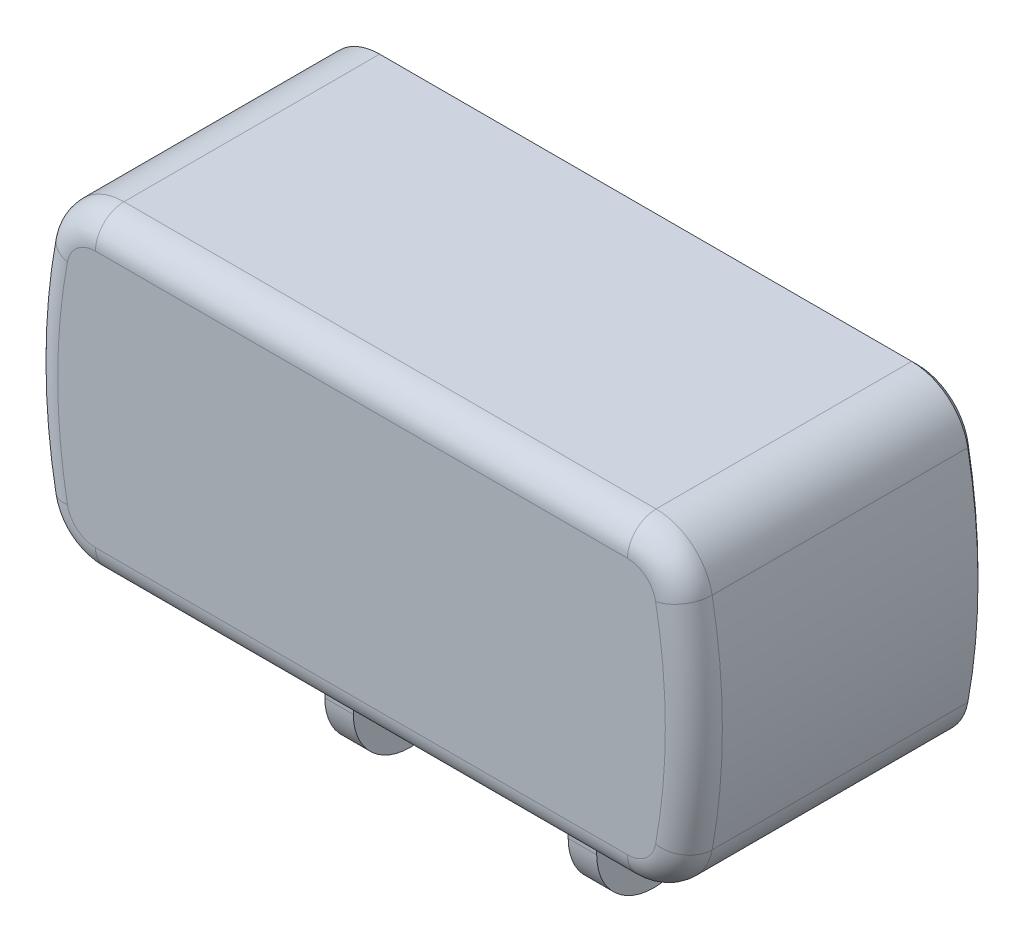
from build123d import *
from OCP.BRepFilletAPI import BRepFilletAPI_MakeChamfer

# Parameters (mm, degrees)
BOSS_EXTRUDE5_DEPTH = 50.8
FILLET9_R           = 5
CHAMFER1_SIZE       = 1
SKETCH8_R           = 1.35
BOSS_EXTRUDE6_DEPTH = 5
CUT_EXTRUDE3_DEPTH  = 20
CHAMFER2_SIZE       = 20
CHAMFER2_SIZE_2     = 0.69841539
SKETCH15_R          = 1.35
CUT_EXTRUDE4_DEPTH  = 5


with BuildPart() as part:
    # Sketch2 → Boss-Extrude5 (new body)
    with BuildSketch(Plane.XY):
        with BuildLine():
            Line((46.625, 27.5), (-46.625, 27.5))
            ThreePointArc((-46.625, 27.5), (-53.017219792, 25.190222762), (-56.456518829, 19.327905227))
            ThreePointArc((-56.456518829, 19.327905227), (-58.238005123, 0), (-56.456518829, -19.327905227))
            ThreePointArc((-56.456518829, -19.327905227), (-53.017219792, -25.190222762), (-46.625, -27.5))
            Line((-46.625, -27.5), (46.625, -27.5))
            ThreePointArc((46.625, -27.5), (53.017219792, -25.190222762), (56.456518829, -19.327905227))
            ThreePointArc((56.456518829, -19.327905227), (58.238005123, 0), (56.456518829, 19.327905227))
            ThreePointArc((56.456518829, 19.327905227), (53.017219792, 25.190222762), (46.625, 27.5))
        make_face()
    extrude(amount=BOSS_EXTRUDE5_DEPTH)

    # Fillet9
    fillet9_edges = [part.edges().sort_by_distance(p)[0] for p in [
        (53.017219792, -25.190222762, 50.8),
        (58.238005123, 0, 50.8),
        (53.017219792, 25.190222762, 50.8),
        (0, 27.5, 50.8),
        (-53.017219792, 25.190222762, 50.8),
        (-58.238005123, 0, 50.8),
        (-53.017219792, -25.190222762, 50.8),
        (0, -27.5, 50.8),
    ]]
    fillet(fillet9_edges, radius=FILLET9_R)

    # Chamfer1
    chamfer1_edges = [part.edges().sort_by_distance(p)[0] for p in [
        (58.238005123, 0, 0),
        (53.017219792, -25.190222762, 0),
        (0, -27.5, 0),
        (-53.017219792, -25.190222762, 0),
        (-58.238005123, 0, 0),
        (-53.017219792, 25.190222762, 0),
        (0, 27.5, 0),
        (53.017219792, 25.190222762, 0),
    ]]
    chamfer(chamfer1_edges, length=CHAMFER1_SIZE)

    # Sketch8 → Boss-Extrude6 (add)
    # profile 1 of 2: a face of its own
    with BuildSketch(Plane(origin=(18.825019181, 0, 0), x_dir=(0, 0, -1), z_dir=(1, 0, 0))):
        with BuildLine():
            Line((-13.405087735, -32.61), (-8.405087735, -27.5))
            Line((-8.405087735, -27.5), (-13.405087735, -27.5))
            Line((-13.405087735, -27.5), (-33.413673421, -27.5))
            Line((-33.413673421, -27.5), (-38.413673421, -27.5))
            Line((-38.413673421, -27.5), (-33.405087735, -32.61))
            Line((-33.405087735, -32.61), (-33.405087735, -42.61))
            ThreePointArc((-33.405087735, -42.61), (-23.405087735, -52.61), (-13.405087735, -42.61))
            Line((-13.405087735, -42.61), (-13.405087735, -32.61))
        make_face()
        with BuildLine():
            ThreePointArc((-33.105086536, -42.61), (-23.405087735, -32.910001198), (-13.705088933, -42.61))
            ThreePointArc((-13.705088933, -42.61), (-23.405087735, -52.309998802), (-33.105086536, -42.61))
        make_face(mode=Mode.SUBTRACT)
    # profile 2 of 2: a face of its own
    with BuildSketch(Plane(origin=(18.825019181, 0, 0), x_dir=(0, 0, -1), z_dir=(1, 0, 0))):
        with BuildLine():
            ThreePointArc((-33.105086536, -42.61), (-23.405087735, -52.309998802), (-13.705088933, -42.61))
            ThreePointArc((-13.705088933, -42.61), (-23.405087735, -32.910001198), (-33.105086536, -42.61))
        make_face()
        with Locations((-30.405089608, -42.61)):
            Circle(SKETCH8_R, mode=Mode.SUBTRACT)
        with Locations((-23.405087735, -49.610001873)):
            Circle(SKETCH8_R, mode=Mode.SUBTRACT)
        with Locations((-16.405085862, -42.61)):
            Circle(SKETCH8_R, mode=Mode.SUBTRACT)
        with Locations((-23.405087735, -35.609998127)):
            Circle(SKETCH8_R, mode=Mode.SUBTRACT)
        with BuildLine():
            ThreePointArc((-21.805087735, -42.61), (-23.405087735, -44.21), (-25.005087735, -42.61))
            ThreePointArc((-25.005087735, -42.61), (-23.405087735, -41.01), (-21.805087735, -42.61))
        make_face(mode=Mode.SUBTRACT)
    boss_extrude6 = extrude(amount=BOSS_EXTRUDE6_DEPTH)

    # Mirror1: Boss-Extrude6 across plane
    add(boss_extrude6.mirror(Plane(origin=(0, 0, 0), x_dir=(0, 0, 1), z_dir=(1, 0, 0))))

    # Sketch4 → Cut-Extrude3 (cut)
    with BuildSketch(Plane(origin=(0, 0, 0), x_dir=(-1, 0, 0), z_dir=(0, 0, -1))):
        with BuildLine():
            Line((-40.665, 14.165), (40.665, 14.165))
            ThreePointArc((40.665, 14.165), (44.200533906, 12.700533906), (45.665, 9.165))
            Line((45.665, 9.165), (45.665, -9.165))
            ThreePointArc((45.665, -9.165), (44.200533906, -12.700533906), (40.665, -14.165))
            Line((40.665, -14.165), (-40.665, -14.165))
            ThreePointArc((-40.665, -14.165), (-44.200533906, -12.700533906), (-45.665, -9.165))
            Line((-45.665, -9.165), (-45.665, 9.165))
            ThreePointArc((-45.665, 9.165), (-44.200533906, 12.700533906), (-40.665, 14.165))
        make_face()
    extrude(amount=-CUT_EXTRUDE3_DEPTH, mode=Mode.SUBTRACT)

    # Chamfer2
    chamfer2_edges_1 = [part.edges().sort_by_distance(p)[0] for p in [
        (-45.665, 0, 20),
    ]]
    chamfer2_side_1 = [part.faces().sort_by_distance(p)[0] for p in [
        (-45.665, 0, 19.986031692),
    ]]
    chamfer2_edges_2 = [part.edges().sort_by_distance(p)[0] for p in [
        (-44.200533906, 12.700533906, 20),
    ]]
    chamfer2_side_2 = [part.faces().sort_by_distance(p)[0] for p in [
        (-44.200533906, 12.700533906, 19.986031692),
    ]]
    chamfer2_edges_3 = [part.edges().sort_by_distance(p)[0] for p in [
        (-44.200533906, -12.700533906, 20),
    ]]
    chamfer2_side_3 = [part.faces().sort_by_distance(p)[0] for p in [
        (-44.200533906, -12.700533906, 19.986031692),
    ]]
    chamfer2_edges_4 = [part.edges().sort_by_distance(p)[0] for p in [
        (0, 14.165, 20),
    ]]
    chamfer2_side_4 = [part.faces().sort_by_distance(p)[0] for p in [
        (0, 14.165, 19.986031692),
    ]]
    chamfer2_edges_5 = [part.edges().sort_by_distance(p)[0] for p in [
        (0, -14.165, 20),
    ]]
    chamfer2_side_5 = [part.faces().sort_by_distance(p)[0] for p in [
        (0, -14.165, 19.986031692),
    ]]
    chamfer2_edges_6 = [part.edges().sort_by_distance(p)[0] for p in [
        (44.200533906, 12.700533906, 20),
    ]]
    chamfer2_side_6 = [part.faces().sort_by_distance(p)[0] for p in [
        (44.200533906, 12.700533906, 19.986031692),
    ]]
    chamfer2_edges_7 = [part.edges().sort_by_distance(p)[0] for p in [
        (44.200533906, -12.700533906, 20),
    ]]
    chamfer2_side_7 = [part.faces().sort_by_distance(p)[0] for p in [
        (44.200533906, -12.700533906, 19.986031692),
    ]]
    chamfer2_edges_8 = [part.edges().sort_by_distance(p)[0] for p in [
        (45.665, 0, 20),
    ]]
    chamfer2_side_8 = [part.faces().sort_by_distance(p)[0] for p in [
        (45.665, 0, 19.986031692),
    ]]
    chamfer2 = BRepFilletAPI_MakeChamfer(part.part.solid().wrapped)
    for e in chamfer2_edges_1:
        chamfer2.Add(CHAMFER2_SIZE - 0.0001, CHAMFER2_SIZE_2 - 0.0001, e.wrapped, chamfer2_side_1[0].wrapped)
    for e in chamfer2_edges_2:
        chamfer2.Add(CHAMFER2_SIZE - 0.0001, CHAMFER2_SIZE_2 - 0.0001, e.wrapped, chamfer2_side_2[0].wrapped)
    for e in chamfer2_edges_3:
        chamfer2.Add(CHAMFER2_SIZE - 0.0001, CHAMFER2_SIZE_2 - 0.0001, e.wrapped, chamfer2_side_3[0].wrapped)
    for e in chamfer2_edges_4:
        chamfer2.Add(CHAMFER2_SIZE - 0.0001, CHAMFER2_SIZE_2 - 0.0001, e.wrapped, chamfer2_side_4[0].wrapped)
    for e in chamfer2_edges_5:
        chamfer2.Add(CHAMFER2_SIZE - 0.0001, CHAMFER2_SIZE_2 - 0.0001, e.wrapped, chamfer2_side_5[0].wrapped)
    for e in chamfer2_edges_6:
        chamfer2.Add(CHAMFER2_SIZE - 0.0001, CHAMFER2_SIZE_2 - 0.0001, e.wrapped, chamfer2_side_6[0].wrapped)
    for e in chamfer2_edges_7:
        chamfer2.Add(CHAMFER2_SIZE - 0.0001, CHAMFER2_SIZE_2 - 0.0001, e.wrapped, chamfer2_side_7[0].wrapped)
    for e in chamfer2_edges_8:
        chamfer2.Add(CHAMFER2_SIZE - 0.0001, CHAMFER2_SIZE_2 - 0.0001, e.wrapped, chamfer2_side_8[0].wrapped)
    add(Compound.cast(chamfer2.Shape()), mode=Mode.REPLACE)  # a hair under: the kernel refuses the full size

    # Sketch15 → Cut-Extrude4 (cut)
    with BuildSketch(Plane(origin=(0, 0, 0), x_dir=(-1, 0, 0), z_dir=(0, 0, -1))):
        with Locations((-48.289265859, 18.560867196)):
            Circle(SKETCH15_R)
        with Locations((48.289265859, -18.560867196)):
            Circle(SKETCH15_R)
        with Locations((48.289265859, 18.560867196)):
            Circle(SKETCH15_R)
        with Locations((-48.289265859, -18.560867196)):
            Circle(SKETCH15_R)
    extrude(amount=-CUT_EXTRUDE4_DEPTH, mode=Mode.SUBTRACT)


solid = part.part
